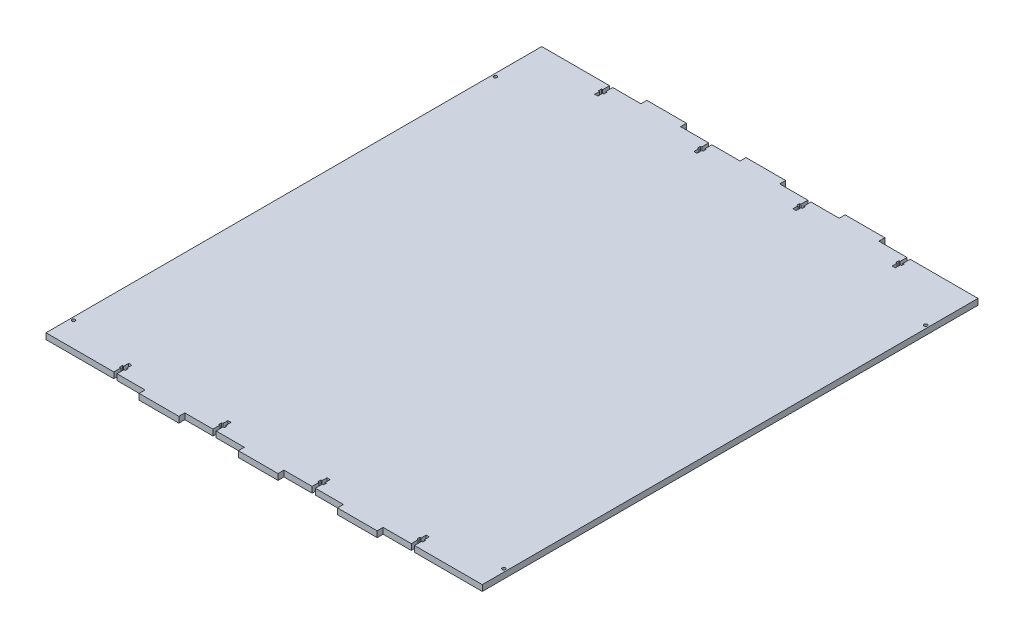
from build123d import *

# Parameters (mm, degrees)
SKETCH1_W           = 440
SKETCH1_H           = 500
BOSS_EXTRUDE1_DEPTH = 6
SKETCH2_W           = 40
SKETCH2_H           = 6
BOSS_EXTRUDE2_DEPTH = 6
SKETCH3_R           = 1.6
CUT_EXTRUDE1_DEPTH  = 338.597393355


with BuildPart() as part:
    # Sketch1 → Boss-Extrude1 (new body)
    with BuildSketch(Plane(origin=(0, 0, 0), x_dir=(1, 0, 0), z_dir=(0, 1, 0))):
        Rectangle(SKETCH1_W, SKETCH1_H)
    extrude(amount=BOSS_EXTRUDE1_DEPTH)

    # Sketch2 → Boss-Extrude2 (add)
    with BuildSketch(Plane.XZ):
        with Locations((-100, 253)):
            Rectangle(SKETCH2_W, SKETCH2_H)
        with Locations((0, 253)):
            Rectangle(SKETCH2_W, SKETCH2_H)
        with Locations((100, 253)):
            Rectangle(SKETCH2_W, SKETCH2_H)
        with Locations((100, -253)):
            Rectangle(SKETCH2_W, SKETCH2_H)
        with Locations((0, -253)):
            Rectangle(SKETCH2_W, SKETCH2_H)
        with Locations((-100, -253)):
            Rectangle(SKETCH2_W, SKETCH2_H)
    extrude(amount=-BOSS_EXTRUDE2_DEPTH)

    # Sketch3 → Cut-Extrude1 (cut, through all)
    with BuildSketch(Plane.XZ):
        Polygon((-148.4, -235), (-151.6, -235), (-151.6, -240), (-152.8, -240), (-152.8, -243), (-151.6, -243), (-151.6, -250), (-148.4, -250), (-148.4, -243), (-147.2, -243), (-147.2, -240), (-148.4, -240), align=None)
        Polygon((-48.4, -235), (-51.6, -235), (-51.6, -240), (-52.8, -240), (-52.8, -243), (-51.6, -243), (-51.6, -250), (-48.4, -250), (-48.4, -243), (-47.2, -243), (-47.2, -240), (-48.4, -240), align=None)
        Polygon((51.6, -235), (48.4, -235), (48.4, -240), (47.2, -240), (47.2, -243), (48.4, -243), (48.4, -250), (51.6, -250), (51.6, -243), (52.8, -243), (52.8, -240), (51.6, -240), align=None)
        Polygon((151.6, -235), (148.4, -235), (148.4, -240), (147.2, -240), (147.2, -243), (148.4, -243), (148.4, -250), (151.6, -250), (151.6, -243), (152.8, -243), (152.8, -240), (151.6, -240), align=None)
        Polygon((-148.4, 235), (-148.4, 240), (-147.2, 240), (-147.2, 243), (-148.4, 243), (-148.4, 250), (-151.6, 250), (-151.6, 243), (-152.8, 243), (-152.8, 240), (-151.6, 240), (-151.6, 235), align=None)
        Polygon((-48.4, 235), (-48.4, 240), (-47.2, 240), (-47.2, 243), (-48.4, 243), (-48.4, 250), (-51.6, 250), (-51.6, 243), (-52.8, 243), (-52.8, 240), (-51.6, 240), (-51.6, 235), align=None)
        Polygon((51.6, 235), (51.6, 240), (52.8, 240), (52.8, 243), (51.6, 243), (51.6, 250), (48.4, 250), (48.4, 243), (47.2, 243), (47.2, 240), (48.4, 240), (48.4, 235), align=None)
        Polygon((151.6, 235), (151.6, 240), (152.8, 240), (152.8, 243), (151.6, 243), (151.6, 250), (148.4, 250), (148.4, 243), (147.2, 243), (147.2, 240), (148.4, 240), (148.4, 235), align=None)
        with Locations((217, -200.25)):
            Circle(SKETCH3_R)
        with Locations((217, 225.25)):
            Circle(SKETCH3_R)
        with Locations((-217, 225.25)):
            Circle(SKETCH3_R)
        with Locations((-217, -200.25)):
            Circle(SKETCH3_R)
    extrude(amount=-CUT_EXTRUDE1_DEPTH, mode=Mode.SUBTRACT)


solid = part.part
